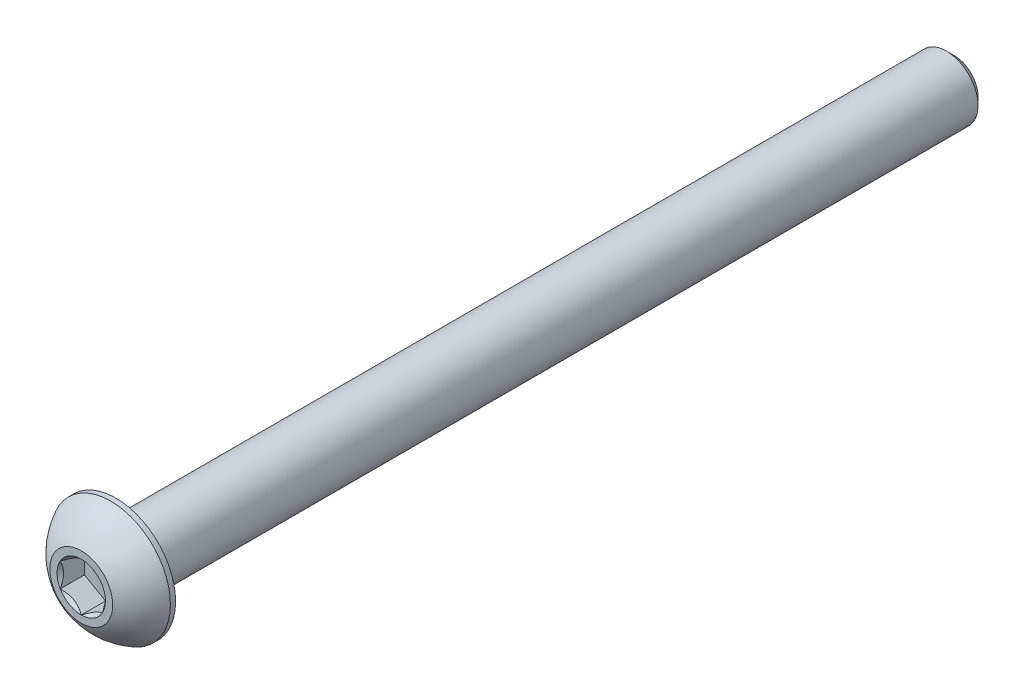
from build123d import *

# Parameters (mm, degrees)
SKETCH1_W          = 40
SKETCH1_H          = 1.5
CHAMFER1_SIZE      = 0.375
CUT_EXTRUDE2_DEPTH = 1.155


with BuildPart() as part:
    # Sketch1 → Revolve1 (revolve)
    with BuildSketch(Plane(origin=(0, 0, 0), x_dir=(0, 0, -1), z_dir=(1, 0, 0))):
        with Locations((21.65, 0.75)):
            Rectangle(SKETCH1_W, SKETCH1_H)
    revolve(axis=Axis((0, 0, -41.65), (0, 0, 1)))

    # Chamfer1
    chamfer1_edges = [part.edges().sort_by_distance(p)[0] for p in [
        (0, -1.5, -41.65),
    ]]
    chamfer(chamfer1_edges, length=CHAMFER1_SIZE)

    # Sketch7 → Revolve2 (revolve)
    with BuildSketch(Plane(origin=(0, 0, 0), x_dir=(0, 0, -1), z_dir=(1, 0, 0))):
        with BuildLine():
            Line((1.4025, 2.85), (1.65, 2.85))
            Line((1.65, 2.85), (1.65, 0))
            Line((1.65, 0), (0, 0))
            Line((0, 0), (0, 1.5))
            ThreePointArc((0, 1.5), (0.59512511, 2.285251969), (1.4025, 2.85))
        make_face()
    revolve(axis=Axis((0, 0, 0), (0, 0, -1)))

    # Sketch5 → Cut-Extrude2 (cut)
    with BuildSketch(Plane.XY):
        Polygon((1, -0.577350269), (1, 0.577350269), (0, 1.154700538), (-1, 0.577350269), (-1, -0.577350269), (0, -1.154700538), align=None)
    extrude(amount=-CUT_EXTRUDE2_DEPTH, mode=Mode.SUBTRACT)

    # Cut-Extrude3 cone 1 section (through the dimple's axis) → Cut-Extrude3 (revolve, cut)
    with BuildSketch(Plane(origin=(0, 0, 0), x_dir=(0, -1, 0), z_dir=(1, 0, 0))):
        Polygon((0, 0), (1.154700538, 0), (0, 1.154700538), align=None)
    revolve(axis=Axis((0, 0, 0), (0, 0, -1)), mode=Mode.SUBTRACT)


solid = part.part
